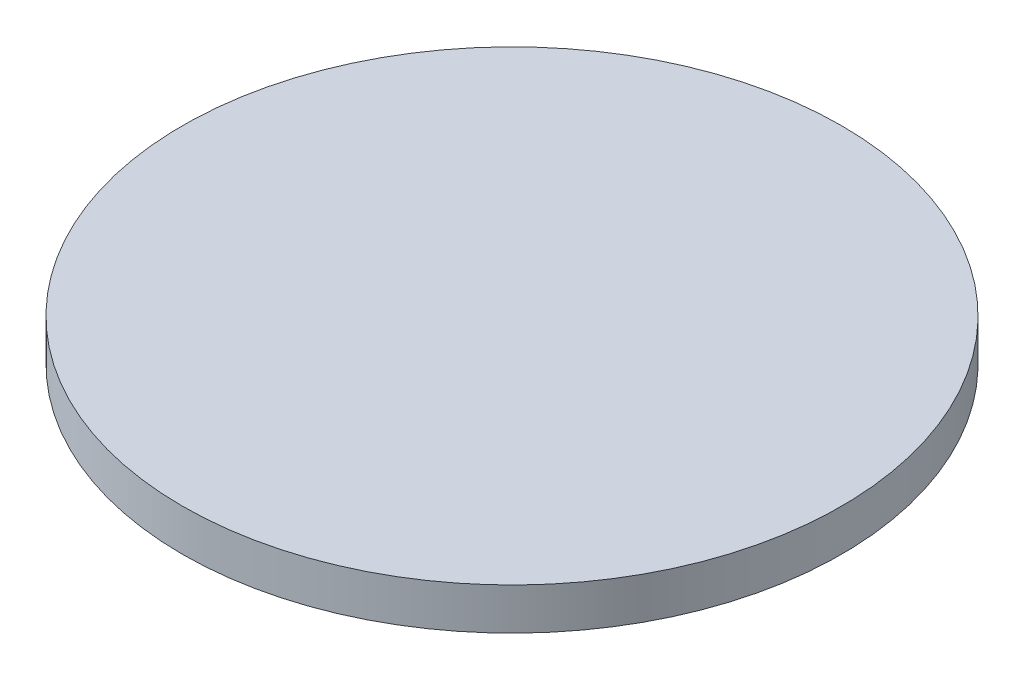
from build123d import *

# Parameters (mm, degrees)
SKETCH1_R           = 7.9
BOSS_EXTRUDE1_DEPTH = 1


with BuildPart() as part:
    # Sketch1 → Boss-Extrude1 (new body)
    with BuildSketch(Plane(origin=(0, 0, 0), x_dir=(1, 0, 0), z_dir=(0, 1, 0))):
        Circle(SKETCH1_R)
    extrude(amount=BOSS_EXTRUDE1_DEPTH)


solid = part.part
